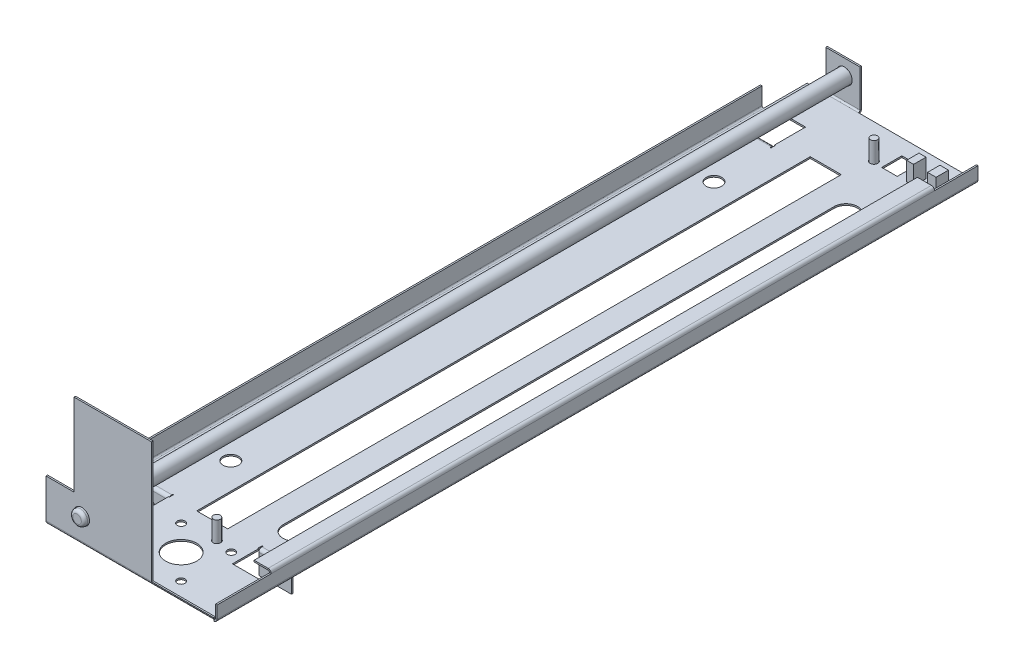
from build123d import *

# Parameters (mm, degrees)
SKETCH1_W                    = 110
SKETCH1_H                    = 1
BASE_FLANGE1_DEPTH           = 490
EDGE_FLANGE1_STRIP_W         = 6
EDGE_FLANGE1_STRIP_H         = 1
EDGE_FLANGE1_STRIP_CUT_DEPTH = 490
EDGE_FLANGE1_DEPTH           = 490
MITER_START                  = 28
MITER_FLANGE1_DEPTH          = 427
EDGE_FLANGE2_STRIP_W         = 6
EDGE_FLANGE2_STRIP_H         = 1
EDGE_FLANGE2_STRIP_CUT_DEPTH = 108
EDGE_FLANGE2_DEPTH           = 108
CUT_EXTRUDE1_REACH           = 510.371
SKETCH13_W                   = 18
SKETCH13_H                   = 53
SKETCH13_W_2                 = 40
SKETCH13_H_2                 = 78
MITER_START_2                = 11
MITER_FLANGE2_DEPTH          = 22
SKETCH15_R                   = 5
CUT_EXTRUDE2_DEPTH           = 511.298932
CUT_EXTRUDE3_REACH           = 510.527
SKETCH17_R                   = 7.5
SKETCH17_W                   = 20
SKETCH17_H                   = 395
SKETCH17_R_2                 = 5
SKETCH17_H_2                 = 20
SKETCH17_W_2                 = 10
SKETCH17_H_3                 = 13
SKETCH17_W_3                 = 3
SKETCH17_H_4                 = 8
SKETCH17_W_4                 = 2
SKETCH17_H_5                 = 2
SKETCH17_W_5                 = 21
SKETCH17_H_6                 = 17
EDGE_FLANGE3_START           = -2
EDGE_FLANGE3_DEPTH           = 3
EDGE_FLANGE3_START_2         = -15
EDGE_FLANGE3_2_OUTLINE_W     = 21
EDGE_FLANGE3_2_OUTLINE_H     = 1
EDGE_FLANGE3_2_OUTLINE_W_2   = 20
EDGE_FLANGE3_2_DEPTH         = 13
EDGE_FLANGE3_START_3         = 4
EDGE_FLANGE3_3_DEPTH         = 20
EDGE_FLANGE3_START_4         = 83
EDGE_FLANGE3_4_DEPTH         = 21
EDGE_FLANGE3_START_5         = 24
EDGE_FLANGE3_5_DEPTH         = 1
EDGE_FLANGE3_6_DEPTH         = 20
EDGE_FLANGE3_7_DEPTH         = 21
EDGE_FLANGE3_8_DEPTH         = 1
SKETCH27_R                   = 1.5
CUT_EXTRUDE4_DEPTH           = 466.151588195
CUT_EXTRUDE5_REACH           = 459.504
SKETCH28_R                   = 1.5
CUT_EXTRUDE6_REACH           = 510.527
SKETCH29_R                   = 10
SKETCH29_R_2                 = 2.5
BOSS_EXTRUDE1_DEPTH          = 3
BOSS_EXTRUDE1_DEPTH_BACK     = 495
SKETCH30_R                   = 4.75
FILLET1_R                    = 2
SKETCH31_R                   = 2.25
BOSS_EXTRUDE2_DEPTH          = 14
BOSS_EXTRUDE2_2_DEPTH        = 14
BOSS_EXTRUDE7_DEPTH          = 12
BOSS_EXTRUDE7_DEPTH_BACK     = 1
SKETCH32_W                   = 4.539788487
SKETCH32_H                   = 8
SKETCH32_W_2                 = 3.502155109
SKETCH32_W_3                 = 2
MITER_FLANGE3_DEPTH          = 427
SKETCH37_R                   = 2.5
CUT_EXTRUDE7_DEPTH           = 1


with BuildPart() as part:
    # Base-Flange1: sheet metal written as solids
    # Sketch1 → Base-Flange1 (new body)
    with BuildSketch(Plane.XY):
        with Locations((55, -0.5)):
            Rectangle(SKETCH1_W, SKETCH1_H)
    extrude(amount=BASE_FLANGE1_DEPTH)

    # Edge-Flange1: sheet metal written as solids
    # Edge-Flange1 strip (on a plane across the edge) → Edge-Flange1 strip cut (cut)
    with BuildSketch(Plane(origin=(110, 0, 490), x_dir=(-1, 0, 0), z_dir=(0, 0, -1))):
        with Locations((-1, -0.5)):
            Rectangle(EDGE_FLANGE1_STRIP_W, EDGE_FLANGE1_STRIP_H)
    extrude(amount=EDGE_FLANGE1_STRIP_CUT_DEPTH, mode=Mode.SUBTRACT)

    # Edge-Flange1 section (on a plane across the edge) → Edge-Flange1 (add)
    with BuildSketch(Plane(origin=(110, 0, 490), x_dir=(-1, 0, 0), z_dir=(0, 0, -1))):
        with BuildLine():
            Line((0, 1), (0, 9))
            Line((0, 9), (1, 9))
            Line((1, 9), (1, 1))
            ThreePointArc((1, 1), (1.292893219, 0.292893219), (2, 0))
            Line((2, 0), (2, -1))
            ThreePointArc((2, -1), (0.585786438, -0.414213562), (0, 1))
        make_face()
    extrude(amount=EDGE_FLANGE1_DEPTH)

    # Miter Flange1: read off the stored shape, not the designer's step
    # Miter Flange1 outline → Miter Flange1 (add)
    with BuildSketch(Plane.XY.offset(MITER_START)):
        with BuildLine():
            Line((-1, 12), (-2, 12))
            Line((-2, 12), (-2, 1))
            ThreePointArc((-2, 1), (-1.414213562, -0.414213562), (0, -1))
            Line((0, -1), (0, 0))
            ThreePointArc((0, 0), (-0.707106781, 0.292893219), (-1, 1))
            Line((-1, 1), (-1, 12))
        make_face()
    extrude(amount=MITER_FLANGE1_DEPTH)

    # Edge-Flange2: sheet metal written as solids
    # Edge-Flange2 strip (on a plane across the edge) → Edge-Flange2 strip cut (cut)
    with BuildSketch(Plane(origin=(0, 0, 490), x_dir=(0, 0, -1), z_dir=(1, 0, 0))):
        with Locations((-1, -0.5)):
            Rectangle(EDGE_FLANGE2_STRIP_W, EDGE_FLANGE2_STRIP_H)
    extrude(amount=EDGE_FLANGE2_STRIP_CUT_DEPTH, mode=Mode.SUBTRACT)

    # Edge-Flange2 section (on a plane across the edge) → Edge-Flange2 (add)
    with BuildSketch(Plane(origin=(0, 0, 490), x_dir=(0, 0, -1), z_dir=(1, 0, 0))):
        with BuildLine():
            Line((0, 1), (0, 79))
            Line((0, 79), (1, 79))
            Line((1, 79), (1, 1))
            ThreePointArc((1, 1), (1.292893219, 0.292893219), (2, 0))
            Line((2, 0), (2, -1))
            ThreePointArc((2, -1), (0.585786438, -0.414213562), (0, 1))
        make_face()
    extrude(amount=EDGE_FLANGE2_DEPTH)

    # Sketch13 → Cut-Extrude1 (cut, up to next)
    with BuildSketch(Plane.XY.offset(490), mode=Mode.PRIVATE) as cut_extrude1_sk1:
        with Locations((9, 52.5)):
            Rectangle(SKETCH13_W, SKETCH13_H)
    cut_extrude1_tool1 = extrude(cut_extrude1_sk1.sketch, amount=-CUT_EXTRUDE1_REACH, mode=Mode.PRIVATE) & part.part
    # Sketch13 → Cut-Extrude1 (cut, up to next)
    with BuildSketch(Plane.XY.offset(490), mode=Mode.PRIVATE) as cut_extrude1_sk2:
        with Locations((88, 40)):
            Rectangle(SKETCH13_W_2, SKETCH13_H_2)
    cut_extrude1_tool2 = extrude(cut_extrude1_sk2.sketch, amount=-CUT_EXTRUDE1_REACH, mode=Mode.PRIVATE) & part.part
    add(cut_extrude1_tool1.solids().sort_by_distance((9, 52.5, 490))[0], mode=Mode.SUBTRACT)
    add(cut_extrude1_tool2.solids().sort_by_distance((88, 40, 490))[0], mode=Mode.SUBTRACT)

    # Miter Flange2: read off the stored shape, not the designer's step
    # Miter Flange2 outline → Miter Flange2 (add)
    with BuildSketch(Plane.YZ.offset(MITER_START_2)):
        with BuildLine():
            Line((25, -2), (25, -1))
            Line((25, -1), (1, -1))
            ThreePointArc((1, -1), (0.292893219, -0.707106781), (0, 0))
            Line((0, 0), (-1, 0))
            ThreePointArc((-1, 0), (-0.414213562, -1.414213562), (1, -2))
            Line((1, -2), (25, -2))
        make_face()
    extrude(amount=MITER_FLANGE2_DEPTH)

    # Sketch15 → Cut-Extrude2 (cut, through all)
    with BuildSketch(Plane(origin=(0, 0, -2), x_dir=(-1, 0, 0), z_dir=(0, 0, -1))):
        with Locations((-23, 15)):
            Circle(SKETCH15_R)
    extrude(amount=-CUT_EXTRUDE2_DEPTH, mode=Mode.SUBTRACT)

    # Sketch17 → Cut-Extrude3 (cut, up to next)
    with BuildSketch(Plane.XZ.offset(1), mode=Mode.PRIVATE) as cut_extrude3_sk1:
        with BuildLine():
            ThreePointArc((92.5, 415), (85, 407.5), (77.5, 415))
            Line((77.5, 415), (77.5, 60))
            ThreePointArc((77.5, 60), (85, 67.5), (92.5, 60))
            Line((92.5, 60), (92.5, 415))
        make_face()
    cut_extrude3_tool1 = extrude(cut_extrude3_sk1.sketch, amount=-CUT_EXTRUDE3_REACH, mode=Mode.PRIVATE) & part.part
    # Sketch17 → Cut-Extrude3 (cut, up to next)
    with BuildSketch(Plane.XZ.offset(1), mode=Mode.PRIVATE) as cut_extrude3_sk2:
        with Locations((85, 415)):
            Circle(SKETCH17_R)
    cut_extrude3_tool2 = extrude(cut_extrude3_sk2.sketch, amount=-CUT_EXTRUDE3_REACH, mode=Mode.PRIVATE) & part.part
    # Sketch17 → Cut-Extrude3 (cut, up to next)
    with BuildSketch(Plane.XZ.offset(1), mode=Mode.PRIVATE) as cut_extrude3_sk3:
        with Locations((85, 60)):
            Circle(SKETCH17_R)
    cut_extrude3_tool3 = extrude(cut_extrude3_sk3.sketch, amount=-CUT_EXTRUDE3_REACH, mode=Mode.PRIVATE) & part.part
    # Sketch17 → Cut-Extrude3 (cut, up to next)
    with BuildSketch(Plane.XZ.offset(1), mode=Mode.PRIVATE) as cut_extrude3_sk4:
        with Locations((52, 237.5)):
            Rectangle(SKETCH17_W, SKETCH17_H)
    cut_extrude3_tool4 = extrude(cut_extrude3_sk4.sketch, amount=-CUT_EXTRUDE3_REACH, mode=Mode.PRIVATE) & part.part
    # Sketch17 → Cut-Extrude3 (cut, up to next)
    with BuildSketch(Plane.XZ.offset(1), mode=Mode.PRIVATE) as cut_extrude3_sk5:
        with Locations(Location((25, 85, 0), (0, 0, 270))):
            Circle(SKETCH17_R_2)
    cut_extrude3_tool5 = extrude(cut_extrude3_sk5.sketch, amount=-CUT_EXTRUDE3_REACH, mode=Mode.PRIVATE) & part.part
    # Sketch17 → Cut-Extrude3 (cut, up to next)
    with BuildSketch(Plane.XZ.offset(1), mode=Mode.PRIVATE) as cut_extrude3_sk6:
        with Locations((14, 35)):
            Rectangle(SKETCH17_W, SKETCH17_H_2)
    cut_extrude3_tool6 = extrude(cut_extrude3_sk6.sketch, amount=-CUT_EXTRUDE3_REACH, mode=Mode.PRIVATE) & part.part
    # Sketch17 → Cut-Extrude3 (cut, up to next)
    with BuildSketch(Plane.XZ.offset(1), mode=Mode.PRIVATE) as cut_extrude3_sk7:
        with Locations((76, 16.5)):
            Rectangle(SKETCH17_W_2, SKETCH17_H_3)
    cut_extrude3_tool7 = extrude(cut_extrude3_sk7.sketch, amount=-CUT_EXTRUDE3_REACH, mode=Mode.PRIVATE) & part.part
    # Sketch17 → Cut-Extrude3 (cut, up to next)
    with BuildSketch(Plane.XZ.offset(1), mode=Mode.PRIVATE) as cut_extrude3_sk8:
        with Locations((88.5, 19)):
            Rectangle(SKETCH17_W_3, SKETCH17_H_4)
    cut_extrude3_tool8 = extrude(cut_extrude3_sk8.sketch, amount=-CUT_EXTRUDE3_REACH, mode=Mode.PRIVATE) & part.part
    # Sketch17 → Cut-Extrude3 (cut, up to next)
    with BuildSketch(Plane.XZ.offset(1), mode=Mode.PRIVATE) as cut_extrude3_sk9:
        with Locations((105, 16)):
            Rectangle(SKETCH17_W_4, SKETCH17_H_5)
    cut_extrude3_tool9 = extrude(cut_extrude3_sk9.sketch, amount=-CUT_EXTRUDE3_REACH, mode=Mode.PRIVATE) & part.part
    # Sketch17 → Cut-Extrude3 (cut, up to next)
    with BuildSketch(Plane.XZ.offset(1), mode=Mode.PRIVATE) as cut_extrude3_sk10:
        with Locations((105, 22)):
            Rectangle(SKETCH17_W_4, SKETCH17_H_5)
    cut_extrude3_tool10 = extrude(cut_extrude3_sk10.sketch, amount=-CUT_EXTRUDE3_REACH, mode=Mode.PRIVATE) & part.part
    # Sketch17 → Cut-Extrude3 (cut, up to next)
    with BuildSketch(Plane.XZ.offset(1), mode=Mode.PRIVATE) as cut_extrude3_sk11:
        with Locations((93.5, 444.5)):
            Rectangle(SKETCH17_W_5, SKETCH17_H_6)
    cut_extrude3_tool11 = extrude(cut_extrude3_sk11.sketch, amount=-CUT_EXTRUDE3_REACH, mode=Mode.PRIVATE) & part.part
    # Sketch17 → Cut-Extrude3 (cut, up to next)
    with BuildSketch(Plane.XZ.offset(1), mode=Mode.PRIVATE) as cut_extrude3_sk12:
        with Locations((14.5, 444.5)):
            Rectangle(SKETCH17_W_5, SKETCH17_H_6)
    cut_extrude3_tool12 = extrude(cut_extrude3_sk12.sketch, amount=-CUT_EXTRUDE3_REACH, mode=Mode.PRIVATE) & part.part
    # Sketch17 → Cut-Extrude3 (cut, up to next)
    with BuildSketch(Plane.XZ.offset(1), mode=Mode.PRIVATE) as cut_extrude3_sk13:
        with Locations(Location((25, 396, 0), (0, 0, 270))):
            Circle(SKETCH17_R_2)
    cut_extrude3_tool13 = extrude(cut_extrude3_sk13.sketch, amount=-CUT_EXTRUDE3_REACH, mode=Mode.PRIVATE) & part.part
    add(cut_extrude3_tool1.solids().sort_by_distance((85, -1, 237.5))[0], mode=Mode.SUBTRACT)
    add(cut_extrude3_tool2.solids().sort_by_distance((85, -1, 415))[0], mode=Mode.SUBTRACT)
    add(cut_extrude3_tool3.solids().sort_by_distance((85, -1, 60))[0], mode=Mode.SUBTRACT)
    add(cut_extrude3_tool4.solids().sort_by_distance((52, -1, 237.5))[0], mode=Mode.SUBTRACT)
    add(cut_extrude3_tool5.solids().sort_by_distance((25, -1, 85))[0], mode=Mode.SUBTRACT)
    add(cut_extrude3_tool6.solids().sort_by_distance((14, -1, 35))[0], mode=Mode.SUBTRACT)
    add(cut_extrude3_tool7.solids().sort_by_distance((76, -1, 16.5))[0], mode=Mode.SUBTRACT)
    add(cut_extrude3_tool8.solids().sort_by_distance((88.5, -1, 19))[0], mode=Mode.SUBTRACT)
    add(cut_extrude3_tool9.solids().sort_by_distance((105, -1, 16))[0], mode=Mode.SUBTRACT)
    add(cut_extrude3_tool10.solids().sort_by_distance((105, -1, 22))[0], mode=Mode.SUBTRACT)
    add(cut_extrude3_tool11.solids().sort_by_distance((93.5, -1, 444.5))[0], mode=Mode.SUBTRACT)
    add(cut_extrude3_tool12.solids().sort_by_distance((14.5, -1, 444.5))[0], mode=Mode.SUBTRACT)
    add(cut_extrude3_tool13.solids().sort_by_distance((25, -1, 396))[0], mode=Mode.SUBTRACT)

    # Edge-Flange3: read off the stored shape, not the designer's step
    # Edge-Flange3 outline → Edge-Flange3 (cut)
    with BuildSketch(Plane(origin=(0, 0, 0), x_dir=(1, 0, 0), z_dir=(0, 1, 0)).offset(EDGE_FLANGE3_START)):
        with BuildLine():
            Line((104, -433.5), (104, -436))
            Line((104, -436), (104.5, -436))
            Line((104.5, -436), (104.5, -433.5))
            ThreePointArc((104.5, -433.5), (104.25, -433.25), (104, -433.5))
        make_face()
        with BuildLine():
            Line((83, -436), (83, -433.5))
            ThreePointArc((83, -433.5), (82.75, -433.25), (82.5, -433.5))
            Line((82.5, -433.5), (82.5, -436))
            Line((82.5, -436), (83, -436))
        make_face()
        with BuildLine():
            Line((25, -433.5), (25, -436))
            Line((25, -436), (25.5, -436))
            Line((25.5, -436), (25.5, -433.5))
            ThreePointArc((25.5, -433.5), (25.25, -433.25), (25, -433.5))
        make_face()
        with BuildLine():
            Line((4, -436), (4, -433.5))
            ThreePointArc((4, -433.5), (3.75, -433.25), (3.5, -433.5))
            Line((3.5, -433.5), (3.5, -436))
            Line((3.5, -436), (4, -436))
        make_face()
        with BuildLine():
            Line((3.5, -45), (3.5, -47.5))
            ThreePointArc((3.5, -47.5), (3.75, -47.75), (4, -47.5))
            Line((4, -47.5), (4, -45))
            Line((4, -45), (3.5, -45))
        make_face()
        with BuildLine():
            Line((24.5, -45), (24, -45))
            Line((24, -45), (24, -47.5))
            ThreePointArc((24, -47.5), (24.25, -47.75), (24.5, -47.5))
            Line((24.5, -47.5), (24.5, -45))
        make_face()
    extrude(amount=EDGE_FLANGE3_DEPTH, mode=Mode.SUBTRACT)

    # Edge-Flange3 3 outline → Edge-Flange3 3 (cut)
    with BuildSketch(Plane.YZ.offset(EDGE_FLANGE3_START_3)):
        with BuildLine():
            Line((-1, 436), (-1, 435.732050807))
            ThreePointArc((-1, 435.732050807), (-0.267949193, 435), (0, 434))
            Line((0, 434), (0, 436))
            Line((0, 436), (-1, 436))
        make_face()
        with BuildLine():
            Line((0, 45), (0, 47))
            ThreePointArc((0, 47), (-0.267949193, 46), (-1, 45.267949193))
            Line((-1, 45.267949193), (-1, 45))
            Line((-1, 45), (0, 45))
        make_face()
    extrude(amount=EDGE_FLANGE3_3_DEPTH, mode=Mode.SUBTRACT)

    # Edge-Flange3 4 outline → Edge-Flange3 4 (cut)
    with BuildSketch(Plane.YZ.offset(EDGE_FLANGE3_START_4)):
        with BuildLine():
            Line((-1, 436), (-1, 435.732050807))
            ThreePointArc((-1, 435.732050807), (-0.267949193, 435), (0, 434))
            Line((0, 434), (0, 436))
            Line((0, 436), (-1, 436))
        make_face()
    extrude(amount=EDGE_FLANGE3_4_DEPTH, mode=Mode.SUBTRACT)

    # Edge-Flange3 5 outline → Edge-Flange3 5 (cut)
    with BuildSketch(Plane.YZ.offset(EDGE_FLANGE3_START_5)):
        with BuildLine():
            Line((-1, 436), (-1, 435.732050807))
            ThreePointArc((-1, 435.732050807), (-0.267949193, 435), (0, 434))
            Line((0, 434), (0, 436))
            Line((0, 436), (-1, 436))
        make_face()
    extrude(amount=EDGE_FLANGE3_5_DEPTH, mode=Mode.SUBTRACT)



with BuildPart() as body_2:
    # Edge-Flange3 2 outline → Edge-Flange3 2 (new body)
    with BuildSketch(Plane(origin=(0, 0, 0), x_dir=(1, 0, 0), z_dir=(0, 1, 0)).offset(EDGE_FLANGE3_START_2)):
        with Locations((93.5, -435.5)):
            Rectangle(EDGE_FLANGE3_2_OUTLINE_W, EDGE_FLANGE3_2_OUTLINE_H)
        with Locations((14.5, -435.5)):
            Rectangle(EDGE_FLANGE3_2_OUTLINE_W, EDGE_FLANGE3_2_OUTLINE_H)
        with Locations((14, -45.5)):
            Rectangle(EDGE_FLANGE3_2_OUTLINE_W_2, EDGE_FLANGE3_2_OUTLINE_H)
    extrude(amount=EDGE_FLANGE3_2_DEPTH)


with BuildPart() as part_1:
    add(part.part)

    add(body_2.part)  # Edge-Flange3 6 merges body 2
    # Edge-Flange3 6 outline → Edge-Flange3 6 (add)
    with BuildSketch(Plane.YZ.offset(EDGE_FLANGE3_START_3)):
        with BuildLine():
            ThreePointArc((-1, 435.732050807), (-1.48236191, 435.931851652), (-2, 436))
            Line((-2, 436), (-2, 435))
            ThreePointArc((-2, 435), (-1.292893219, 434.707106781), (-1, 434))
            Line((-1, 434), (-1, 435.732050807))
        make_face()
        with BuildLine():
            Line((-1, 45.267949193), (-1, 47))
            ThreePointArc((-1, 47), (-1.292893219, 46.292893219), (-2, 46))
            Line((-2, 46), (-2, 45))
            ThreePointArc((-2, 45), (-1.48236191, 45.068148348), (-1, 45.267949193))
        make_face()
    extrude(amount=EDGE_FLANGE3_6_DEPTH)

    # Edge-Flange3 7 outline → Edge-Flange3 7 (add)
    with BuildSketch(Plane.YZ.offset(EDGE_FLANGE3_START_4)):
        with BuildLine():
            ThreePointArc((-1, 435.732050807), (-1.48236191, 435.931851652), (-2, 436))
            Line((-2, 436), (-2, 435))
            ThreePointArc((-2, 435), (-1.292893219, 434.707106781), (-1, 434))
            Line((-1, 434), (-1, 435.732050807))
        make_face()
    extrude(amount=EDGE_FLANGE3_7_DEPTH)

    # Edge-Flange3 8 outline → Edge-Flange3 8 (add)
    with BuildSketch(Plane.YZ.offset(EDGE_FLANGE3_START_5)):
        with BuildLine():
            ThreePointArc((-1, 435.732050807), (-1.48236191, 435.931851652), (-2, 436))
            Line((-2, 436), (-2, 435))
            ThreePointArc((-2, 435), (-1.292893219, 434.707106781), (-1, 434))
            Line((-1, 434), (-1, 435.732050807))
        make_face()
    extrude(amount=EDGE_FLANGE3_8_DEPTH)

    # Sketch27 → Cut-Extrude4 (cut, through all)
    with BuildSketch(Plane(origin=(0, 0, 45), x_dir=(-1, 0, 0), z_dir=(0, 0, -1))):
        with Locations(Location((-14, -9, 0), (0, 0, 90))):
            Circle(SKETCH27_R)
    extrude(amount=-CUT_EXTRUDE4_DEPTH, mode=Mode.SUBTRACT)

    # Sketch28 → Cut-Extrude5 (cut, up to next)
    with BuildSketch(Plane(origin=(0, 0, 435), x_dir=(-1, 0, 0), z_dir=(0, 0, -1)), mode=Mode.PRIVATE) as cut_extrude5_sk1:
        with Locations(Location((-93.5, -9, 0), (0, 0, 90))):
            Circle(SKETCH28_R)
    cut_extrude5_tool1 = extrude(cut_extrude5_sk1.sketch, amount=-CUT_EXTRUDE5_REACH, mode=Mode.PRIVATE) & part_1.part
    add(cut_extrude5_tool1.solids().sort_by_distance((93.5, -9, 435))[0], mode=Mode.SUBTRACT)

    # Sketch29 → Cut-Extrude6 (cut, up to next)
    with BuildSketch(Plane.XZ.offset(1), mode=Mode.PRIVATE) as cut_extrude6_sk1:
        with Locations(Location((60, 463, 0), (0, 0, 270))):
            Circle(SKETCH29_R)
    cut_extrude6_tool1 = extrude(cut_extrude6_sk1.sketch, amount=-CUT_EXTRUDE6_REACH, mode=Mode.PRIVATE) & part_1.part
    # Sketch29 → Cut-Extrude6 (cut, up to next)
    with BuildSketch(Plane.XZ.offset(1), mode=Mode.PRIVATE) as cut_extrude6_sk2:
        with Locations(Location((65, 445, 0), (0, 0, 270))):
            Circle(SKETCH29_R_2)
    cut_extrude6_tool2 = extrude(cut_extrude6_sk2.sketch, amount=-CUT_EXTRUDE6_REACH, mode=Mode.PRIVATE) & part_1.part
    # Sketch29 → Cut-Extrude6 (cut, up to next)
    with BuildSketch(Plane.XZ.offset(1), mode=Mode.PRIVATE) as cut_extrude6_sk3:
        with Locations(Location((65, 22, 0), (0, 0, 270))):
            Circle(SKETCH29_R_2)
    cut_extrude6_tool3 = extrude(cut_extrude6_sk3.sketch, amount=-CUT_EXTRUDE6_REACH, mode=Mode.PRIVATE) & part_1.part
    add(cut_extrude6_tool1.solids().sort_by_distance((60, -1, 463))[0], mode=Mode.SUBTRACT)
    add(cut_extrude6_tool2.solids().sort_by_distance((65, -1, 445))[0], mode=Mode.SUBTRACT)
    add(cut_extrude6_tool3.solids().sort_by_distance((65, -1, 22))[0], mode=Mode.SUBTRACT)

    # Sketch32 → Boss-Extrude7 (add, two sides: drawn at the far end of the back side and taken through both)
    with BuildSketch(Plane(origin=(0, 0, 0), x_dir=(1, 0, 0), z_dir=(0, 1, 0)).offset(-BOSS_EXTRUDE7_DEPTH_BACK)):
        with Locations((89.269894244, -19)):
            Rectangle(SKETCH32_W, SKETCH32_H)
        with Locations((102.248922445, -19)):
            Rectangle(SKETCH32_W_2, SKETCH32_H)
        with Locations((105, -19)):
            Rectangle(SKETCH32_W_3, SKETCH32_H)
    extrude(amount=BOSS_EXTRUDE7_DEPTH + BOSS_EXTRUDE7_DEPTH_BACK)

    # Miter Flange3: read off the stored shape, not the designer's step
    # Miter Flange3 outline → Miter Flange3 (add)
    with BuildSketch(Plane.XY.offset(MITER_START)):
        with BuildLine():
            Line((99, 11), (99, 10))
            Line((99, 10), (108, 10))
            ThreePointArc((108, 10), (108.707106781, 9.707106781), (109, 9))
            Line((109, 9), (110, 9))
            ThreePointArc((110, 9), (109.414213562, 10.414213562), (108, 11))
            Line((108, 11), (99, 11))
        make_face()
    extrude(amount=MITER_FLANGE3_DEPTH)

    # Sketch37 → Cut-Extrude7 (cut)
    with BuildSketch(Plane.XZ.offset(1)):
        with Locations(Location((76.125, 479.125, 0), (0, 0, 270))):
            Circle(SKETCH37_R)
        with Locations(Location((43.875, 479.125, 0), (0, 0, 270))):
            Circle(SKETCH37_R)
        with Locations(Location((43.875, 446.875, 0), (0, 0, 270))):
            Circle(SKETCH37_R)
        with Locations(Location((76.125, 446.875, 0), (0, 0, 270))):
            Circle(SKETCH37_R)
    extrude(amount=-CUT_EXTRUDE7_DEPTH, mode=Mode.SUBTRACT)


with BuildPart() as body_2_2:
    # Sketch30 → Boss-Extrude1 (new, two sides: drawn at the far end of the back side and taken through both)
    with BuildSketch(Plane.XY.offset(490).offset(-BOSS_EXTRUDE1_DEPTH_BACK)):
        with Locations((23, 15)):
            Circle(SKETCH30_R)
    extrude(amount=BOSS_EXTRUDE1_DEPTH + BOSS_EXTRUDE1_DEPTH_BACK)

    # Fillet1
    fillet1_edges = [body_2_2.edges().sort_by_distance(p)[0] for p in [
        (18.25, 15, -5),
        (18.25, 15, 493),
    ]]
    fillet(fillet1_edges, radius=FILLET1_R)


with BuildPart() as body_3:
    # Sketch31 → Boss-Extrude2 (new body)
    with BuildSketch(Plane.XZ.offset(1)):
        with Locations(Location((65, 22, 0), (0, 0, 270))):
            Circle(SKETCH31_R)
    extrude(amount=-BOSS_EXTRUDE2_DEPTH)


with BuildPart() as body_4:
    # Sketch31 → Boss-Extrude2 2 (new body)
    with BuildSketch(Plane.XZ.offset(1)):
        with Locations(Location((65, 445, 0), (0, 0, 270))):
            Circle(SKETCH31_R)
    extrude(amount=-BOSS_EXTRUDE2_2_DEPTH)


solid = Compound([part_1.part, body_2_2.part, body_3.part, body_4.part])
